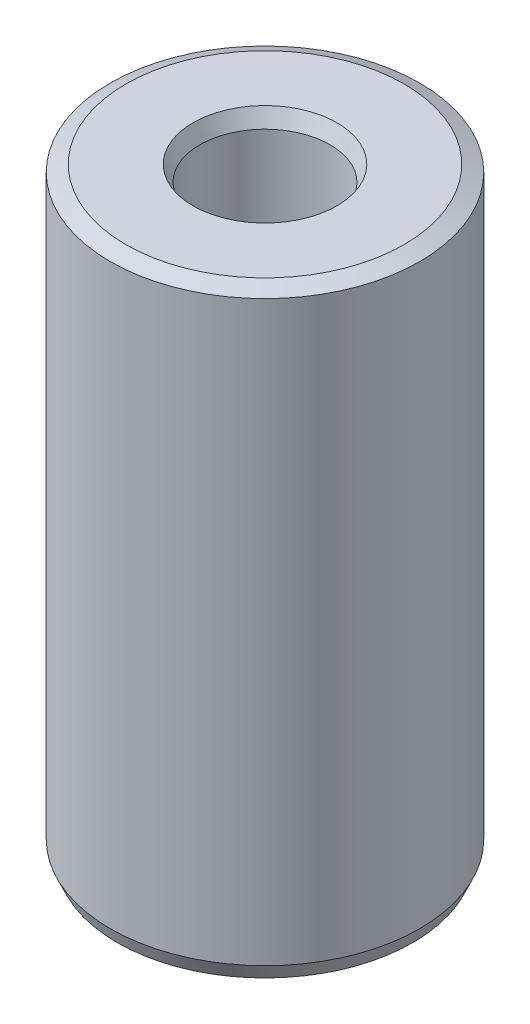
from build123d import *
from OCP.BRepFilletAPI import BRepFilletAPI_MakeChamfer

# Parameters (mm, degrees)
SKETCH1_R           = 55
BOSS_EXTRUDE1_DEPTH = 213.398398543
SKETCH2_R           = 23.130124891
CUT_EXTRUDE1_DEPTH  = 228.131848275
CHAMFER1_SIZE       = 2.466231256
CHAMFER1_SIZE2      = 5.530102021


with BuildPart() as part:
    # Sketch1 → Boss-Extrude1 (new body)
    with BuildSketch(Plane(origin=(0, 0, 0), x_dir=(1, 0, 0), z_dir=(0, 1, 0))):
        Circle(SKETCH1_R)
    extrude(amount=BOSS_EXTRUDE1_DEPTH)

    # Sketch2 → Cut-Extrude1 (cut, through all)
    with BuildSketch(Plane(origin=(0, 0, 0), x_dir=(1, 0, 0), z_dir=(0, 1, 0))):
        Circle(SKETCH2_R)
    extrude(amount=CUT_EXTRUDE1_DEPTH, mode=Mode.SUBTRACT)

    # Chamfer1: one chamfer whose edges measure the first distance from different faces: ONE call of the kernel's chamfer builder (chamfer() names one face for all edges)
    chamfer1_edges_1 = [part.edges().sort_by_distance(p)[0] for p in [
        (-23.130124891, 213.398398543, 0),
    ]]
    chamfer1_side_1 = [part.faces().sort_by_distance(p)[0] for p in [
        (-53.444365081, 213.398398543, 0),
    ]]
    chamfer1_edges_2 = [part.edges().sort_by_distance(p)[0] for p in [
        (-23.130124891, 0, 0),
    ]]
    chamfer1_side_2 = [part.faces().sort_by_distance(p)[0] for p in [
        (-23.130124891, 106.699199271, 0),
    ]]
    chamfer1_edges_3 = [part.edges().sort_by_distance(p)[0] for p in [
        (-55, 0, 0),
    ]]
    chamfer1_side_3 = [part.faces().sort_by_distance(p)[0] for p in [
        (-53.444365081, 0, 0),
    ]]
    chamfer1_edges_4 = [part.edges().sort_by_distance(p)[0] for p in [
        (-55, 213.398398543, 0),
    ]]
    chamfer1_side_4 = [part.faces().sort_by_distance(p)[0] for p in [
        (-55, 106.699199271, 0),
    ]]
    chamfer1 = BRepFilletAPI_MakeChamfer(part.part.solid().wrapped)
    for e in chamfer1_edges_1:
        chamfer1.Add(CHAMFER1_SIZE, CHAMFER1_SIZE2, e.wrapped, chamfer1_side_1[0].wrapped)  # the first distance lies on this face
    for e in chamfer1_edges_2:
        chamfer1.Add(CHAMFER1_SIZE, CHAMFER1_SIZE2, e.wrapped, chamfer1_side_2[0].wrapped)  # the first distance lies on this face
    for e in chamfer1_edges_3:
        chamfer1.Add(CHAMFER1_SIZE, CHAMFER1_SIZE2, e.wrapped, chamfer1_side_3[0].wrapped)  # the first distance lies on this face
    for e in chamfer1_edges_4:
        chamfer1.Add(CHAMFER1_SIZE, CHAMFER1_SIZE2, e.wrapped, chamfer1_side_4[0].wrapped)  # the first distance lies on this face
    add(Compound.cast(chamfer1.Shape()), mode=Mode.REPLACE)


solid = part.part
